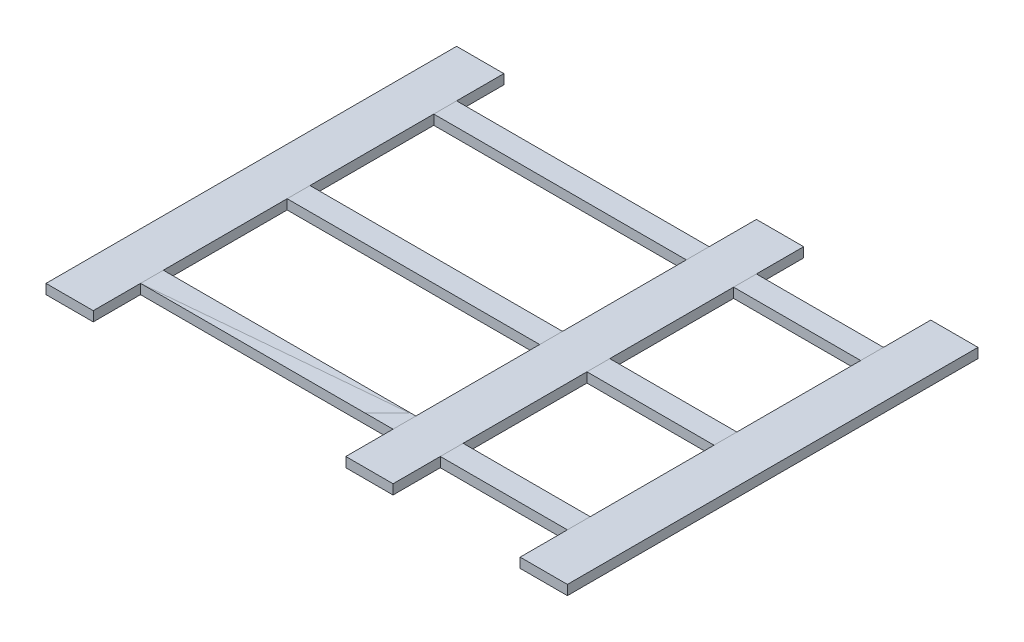
from build123d import *

# Parameters (mm, degrees)
SKETCH112_W                            = 38.1
SKETCH112_H                            = 88.9
WOODEN_STUD_CONFIGURED_2_X_4_2_DEPTH   = 1168.4
SKETCH112_ON_SEGMENT_2_W               = 38.1
SKETCH112_ON_SEGMENT_2_H               = 88.9
WOODEN_STUD_CONFIGURED_2_X_4_2_2_DEPTH = 1168.4
SKETCH112_ON_SEGMENT_3_W               = 38.1
SKETCH112_ON_SEGMENT_3_H               = 88.9
WOODEN_STUD_CONFIGURED_2_X_4_2_3_DEPTH = 1168.4
SKETCH112_ON_SEGMENT_4_W               = 38.1
SKETCH112_ON_SEGMENT_4_H               = 88.9
WOODEN_STUD_CONFIGURED_2_X_4_2_4_DEPTH = 679.45
SKETCH112_ON_SEGMENT_5_W               = 38.1
SKETCH112_ON_SEGMENT_5_H               = 88.9
WOODEN_STUD_CONFIGURED_2_X_4_2_5_DEPTH = 679.45
SKETCH112_ON_SEGMENT_6_W               = 38.1
SKETCH112_ON_SEGMENT_6_H               = 88.9
WOODEN_STUD_CONFIGURED_2_X_4_2_6_DEPTH = 679.45
SKETCH114_W                            = 38.1
SKETCH114_H                            = 184.15
WOODEN_STUD_CONFIGURED_2_X_8_3_DEPTH   = 1600.2
SKETCH114_ON_SEGMENT_2_W               = 38.1
SKETCH114_ON_SEGMENT_2_H               = 184.15
WOODEN_STUD_CONFIGURED_2_X_8_3_2_DEPTH = 1600.2
SKETCH114_ON_SEGMENT_3_W               = 38.1
SKETCH114_ON_SEGMENT_3_H               = 184.15
WOODEN_STUD_CONFIGURED_2_X_8_3_3_DEPTH = 1600.2
TRIM_EXTEND3_START                     = 1168.4
TRIM_EXTEND3_OUTLINE_W                 = 38.1
TRIM_EXTEND3_OUTLINE_H                 = 88.9
TRIM_EXTEND3_DEPTH                     = 92.075
TRIM_EXTEND3_START_2                   = 1755.775
TRIM_EXTEND3_2_OUTLINE_W               = 38.1
TRIM_EXTEND3_2_OUTLINE_H               = 88.9
TRIM_EXTEND3_2_DEPTH                   = 92.075
TRIM_EXTEND3_3_OUTLINE_W               = 38.1
TRIM_EXTEND3_3_OUTLINE_H               = 88.9
TRIM_EXTEND3_3_DEPTH                   = 92.075
TRIM_EXTEND3_START_3                   = 1076.325
TRIM_EXTEND3_4_OUTLINE_W               = 38.1
TRIM_EXTEND3_4_OUTLINE_H               = 88.9
TRIM_EXTEND3_4_DEPTH                   = 92.075
TRIM_EXTEND3_5_OUTLINE_W               = 38.1
TRIM_EXTEND3_5_OUTLINE_H               = 88.9
TRIM_EXTEND3_5_DEPTH                   = 92.075
TRIM_EXTEND3_6_OUTLINE_W               = 38.1
TRIM_EXTEND3_6_OUTLINE_H               = 88.9
TRIM_EXTEND3_6_DEPTH                   = 92.075
TRIM_EXTEND3_7_OUTLINE_W               = 38.1
TRIM_EXTEND3_7_OUTLINE_H               = 88.9
TRIM_EXTEND3_7_DEPTH                   = 92.075
TRIM_EXTEND3_8_OUTLINE_W               = 38.1
TRIM_EXTEND3_8_OUTLINE_H               = 88.9
TRIM_EXTEND3_8_DEPTH                   = 92.075
TRIM_EXTEND3_9_OUTLINE_W               = 38.1
TRIM_EXTEND3_9_OUTLINE_H               = 88.9
TRIM_EXTEND3_9_DEPTH                   = 92.075
TRIM_EXTEND3_10_OUTLINE_W              = 38.1
TRIM_EXTEND3_10_OUTLINE_H              = 88.9
TRIM_EXTEND3_10_DEPTH                  = 92.075
TRIM_EXTEND3_11_OUTLINE_W              = 38.1
TRIM_EXTEND3_11_OUTLINE_H              = 88.9
TRIM_EXTEND3_11_DEPTH                  = 92.075
TRIM_EXTEND3_12_OUTLINE_W              = 38.1
TRIM_EXTEND3_12_OUTLINE_H              = 88.9
TRIM_EXTEND3_12_DEPTH                  = 92.075
TRIM_EXTEND3_START_4                   = -273.05
TRIM_EXTEND3_13_OUTLINE_W              = 495.3
TRIM_EXTEND3_13_OUTLINE_H              = 38.1
TRIM_EXTEND3_13_DEPTH                  = 88.9
TRIM_EXTEND3_14_OUTLINE_W              = 984.25
TRIM_EXTEND3_14_OUTLINE_H              = 38.1
TRIM_EXTEND3_14_DEPTH                  = 88.9
TRIM_EXTEND3_START_5                   = -844.55
TRIM_EXTEND3_15_OUTLINE_W              = 495.3
TRIM_EXTEND3_15_OUTLINE_H              = 38.1
TRIM_EXTEND3_15_DEPTH                  = 88.9
TRIM_EXTEND3_16_OUTLINE_W              = 984.25
TRIM_EXTEND3_16_OUTLINE_H              = 38.1
TRIM_EXTEND3_16_DEPTH                  = 88.9
TRIM_EXTEND3_START_6                   = -1416.05
TRIM_EXTEND3_17_OUTLINE_W              = 495.3
TRIM_EXTEND3_17_OUTLINE_H              = 38.1
TRIM_EXTEND3_17_DEPTH                  = 88.9
TRIM_EXTEND3_18_OUTLINE_W              = 984.25
TRIM_EXTEND3_18_OUTLINE_H              = 38.1
TRIM_EXTEND3_18_DEPTH                  = 88.9


# Read off the part's stored shape, not the designer's step: Trim/Extend3
with BuildPart() as part:
    # Sketch112 → Wooden-stud - configured 2 X 4(2) (new body)
    with BuildSketch(Plane(origin=(0, 0, -228.6), x_dir=(0, 1, 0), z_dir=(1, 0, 0))):
        Rectangle(SKETCH112_W, SKETCH112_H)
    extrude(amount=WOODEN_STUD_CONFIGURED_2_X_4_2_DEPTH)

    # Trim_Extend3 3 outline → Trim_Extend3 3 (cut)
    with BuildSketch(Plane.YZ):
        with Locations((0, -228.6)):
            Rectangle(TRIM_EXTEND3_3_OUTLINE_W, TRIM_EXTEND3_3_OUTLINE_H)
    extrude(amount=TRIM_EXTEND3_3_DEPTH, mode=Mode.SUBTRACT)

    # Trim_Extend3 4 outline → Trim_Extend3 4 (cut)
    with BuildSketch(Plane.YZ.offset(TRIM_EXTEND3_START_3)):
        with Locations((0, -228.6)):
            Rectangle(TRIM_EXTEND3_4_OUTLINE_W, TRIM_EXTEND3_4_OUTLINE_H)
    extrude(amount=TRIM_EXTEND3_4_DEPTH, mode=Mode.SUBTRACT)


with BuildPart() as body_2:
    # Sketch112 on segment 2 (carried to segment 2) → Wooden-stud - configured 2 X 4_2 2 (new body)
    with BuildSketch(Plane(origin=(0, 0, -800.1), x_dir=(0, 1, 0), z_dir=(1, 0, 0))):
        Rectangle(SKETCH112_ON_SEGMENT_2_W, SKETCH112_ON_SEGMENT_2_H)
    extrude(amount=WOODEN_STUD_CONFIGURED_2_X_4_2_2_DEPTH)

    # Trim_Extend3 7 outline → Trim_Extend3 7 (cut)
    with BuildSketch(Plane.YZ):
        with Locations((0, -800.1)):
            Rectangle(TRIM_EXTEND3_7_OUTLINE_W, TRIM_EXTEND3_7_OUTLINE_H)
    extrude(amount=TRIM_EXTEND3_7_DEPTH, mode=Mode.SUBTRACT)

    # Trim_Extend3 8 outline → Trim_Extend3 8 (cut)
    with BuildSketch(Plane.YZ.offset(TRIM_EXTEND3_START_3)):
        with Locations((0, -800.1)):
            Rectangle(TRIM_EXTEND3_8_OUTLINE_W, TRIM_EXTEND3_8_OUTLINE_H)
    extrude(amount=TRIM_EXTEND3_8_DEPTH, mode=Mode.SUBTRACT)


with BuildPart() as body_3:
    # Sketch112 on segment 3 (carried to segment 3) → Wooden-stud - configured 2 X 4_2 3 (new body)
    with BuildSketch(Plane(origin=(0, 0, -1371.6), x_dir=(0, 1, 0), z_dir=(1, 0, 0))):
        Rectangle(SKETCH112_ON_SEGMENT_3_W, SKETCH112_ON_SEGMENT_3_H)
    extrude(amount=WOODEN_STUD_CONFIGURED_2_X_4_2_3_DEPTH)

    # Trim_Extend3 11 outline → Trim_Extend3 11 (cut)
    with BuildSketch(Plane.YZ):
        with Locations((0, -1371.6)):
            Rectangle(TRIM_EXTEND3_11_OUTLINE_W, TRIM_EXTEND3_11_OUTLINE_H)
    extrude(amount=TRIM_EXTEND3_11_DEPTH, mode=Mode.SUBTRACT)

    # Trim_Extend3 12 outline → Trim_Extend3 12 (cut)
    with BuildSketch(Plane.YZ.offset(TRIM_EXTEND3_START_3)):
        with Locations((0, -1371.6)):
            Rectangle(TRIM_EXTEND3_12_OUTLINE_W, TRIM_EXTEND3_12_OUTLINE_H)
    extrude(amount=TRIM_EXTEND3_12_DEPTH, mode=Mode.SUBTRACT)


with BuildPart() as body_4:
    # Sketch112 on segment 4 (carried to segment 4) → Wooden-stud - configured 2 X 4_2 4 (new body)
    with BuildSketch(Plane(origin=(1168.4, 0, -1371.6), x_dir=(0, 1, 0), z_dir=(1, 0, 0))):
        Rectangle(SKETCH112_ON_SEGMENT_4_W, SKETCH112_ON_SEGMENT_4_H)
    extrude(amount=WOODEN_STUD_CONFIGURED_2_X_4_2_4_DEPTH)

    # Trim_Extend3 9 outline → Trim_Extend3 9 (cut)
    with BuildSketch(Plane.YZ.offset(TRIM_EXTEND3_START)):
        with Locations((0, -1371.6)):
            Rectangle(TRIM_EXTEND3_9_OUTLINE_W, TRIM_EXTEND3_9_OUTLINE_H)
    extrude(amount=TRIM_EXTEND3_9_DEPTH, mode=Mode.SUBTRACT)

    # Trim_Extend3 10 outline → Trim_Extend3 10 (cut)
    with BuildSketch(Plane.YZ.offset(TRIM_EXTEND3_START_2)):
        with Locations((0, -1371.6)):
            Rectangle(TRIM_EXTEND3_10_OUTLINE_W, TRIM_EXTEND3_10_OUTLINE_H)
    extrude(amount=TRIM_EXTEND3_10_DEPTH, mode=Mode.SUBTRACT)


with BuildPart() as body_5:
    # Sketch112 on segment 5 (carried to segment 5) → Wooden-stud - configured 2 X 4_2 5 (new body)
    with BuildSketch(Plane(origin=(1168.4, 0, -800.1), x_dir=(0, 1, 0), z_dir=(1, 0, 0))):
        Rectangle(SKETCH112_ON_SEGMENT_5_W, SKETCH112_ON_SEGMENT_5_H)
    extrude(amount=WOODEN_STUD_CONFIGURED_2_X_4_2_5_DEPTH)

    # Trim_Extend3 5 outline → Trim_Extend3 5 (cut)
    with BuildSketch(Plane.YZ.offset(TRIM_EXTEND3_START)):
        with Locations((0, -800.1)):
            Rectangle(TRIM_EXTEND3_5_OUTLINE_W, TRIM_EXTEND3_5_OUTLINE_H)
    extrude(amount=TRIM_EXTEND3_5_DEPTH, mode=Mode.SUBTRACT)

    # Trim_Extend3 6 outline → Trim_Extend3 6 (cut)
    with BuildSketch(Plane.YZ.offset(TRIM_EXTEND3_START_2)):
        with Locations((0, -800.1)):
            Rectangle(TRIM_EXTEND3_6_OUTLINE_W, TRIM_EXTEND3_6_OUTLINE_H)
    extrude(amount=TRIM_EXTEND3_6_DEPTH, mode=Mode.SUBTRACT)


with BuildPart() as body_6:
    # Sketch112 on segment 6 (carried to segment 6) → Wooden-stud - configured 2 X 4_2 6 (new body)
    with BuildSketch(Plane(origin=(1168.4, 0, -228.6), x_dir=(0, 1, 0), z_dir=(1, 0, 0))):
        Rectangle(SKETCH112_ON_SEGMENT_6_W, SKETCH112_ON_SEGMENT_6_H)
    extrude(amount=WOODEN_STUD_CONFIGURED_2_X_4_2_6_DEPTH)

    # Trim/Extend3 outline → Trim/Extend3 (cut)
    with BuildSketch(Plane.YZ.offset(TRIM_EXTEND3_START)):
        with Locations((0, -228.6)):
            Rectangle(TRIM_EXTEND3_OUTLINE_W, TRIM_EXTEND3_OUTLINE_H)
    extrude(amount=TRIM_EXTEND3_DEPTH, mode=Mode.SUBTRACT)

    # Trim_Extend3 2 outline → Trim_Extend3 2 (cut)
    with BuildSketch(Plane.YZ.offset(TRIM_EXTEND3_START_2)):
        with Locations((0, -228.6)):
            Rectangle(TRIM_EXTEND3_2_OUTLINE_W, TRIM_EXTEND3_2_OUTLINE_H)
    extrude(amount=TRIM_EXTEND3_2_DEPTH, mode=Mode.SUBTRACT)


with BuildPart() as body_7:
    # Sketch114 → Wooden-stud - configured 2 X 8(3) (new body)
    with BuildSketch(Plane(origin=(0, 0, -1600.2), x_dir=(0, 1, 0), z_dir=(0, 0, 1))):
        Rectangle(SKETCH114_W, SKETCH114_H)
    extrude(amount=WOODEN_STUD_CONFIGURED_2_X_8_3_DEPTH)


with BuildPart() as body_8:
    # Sketch114 on segment 2 (carried to segment 2) → Wooden-stud - configured 2 X 8_3 2 (new body)
    with BuildSketch(Plane(origin=(1168.4, 0, -1600.2), x_dir=(0, 1, 0), z_dir=(0, 0, 1))):
        Rectangle(SKETCH114_ON_SEGMENT_2_W, SKETCH114_ON_SEGMENT_2_H)
    extrude(amount=WOODEN_STUD_CONFIGURED_2_X_8_3_2_DEPTH)


with BuildPart() as body_9:
    # Sketch114 on segment 3 (carried to segment 3) → Wooden-stud - configured 2 X 8_3 3 (new body)
    with BuildSketch(Plane(origin=(1847.85, 0, -1600.2), x_dir=(0, 1, 0), z_dir=(0, 0, 1))):
        Rectangle(SKETCH114_ON_SEGMENT_3_W, SKETCH114_ON_SEGMENT_3_H)
    extrude(amount=WOODEN_STUD_CONFIGURED_2_X_8_3_3_DEPTH)


with BuildPart() as body_10:
    # Trim_Extend3 13 outline → Trim_Extend3 13 (new body)
    with BuildSketch(Plane.XY.offset(TRIM_EXTEND3_START_4)):
        with Locations((1508.125, 0)):
            Rectangle(TRIM_EXTEND3_13_OUTLINE_W, TRIM_EXTEND3_13_OUTLINE_H)
    extrude(amount=TRIM_EXTEND3_13_DEPTH)


with BuildPart() as body_11:
    # Trim_Extend3 14 outline → Trim_Extend3 14 (new body)
    with BuildSketch(Plane.XY.offset(TRIM_EXTEND3_START_4)):
        with Locations((584.2, 0)):
            Rectangle(TRIM_EXTEND3_14_OUTLINE_W, TRIM_EXTEND3_14_OUTLINE_H)
    extrude(amount=TRIM_EXTEND3_14_DEPTH)


with BuildPart() as body_12:
    # Trim_Extend3 15 outline → Trim_Extend3 15 (new body)
    with BuildSketch(Plane.XY.offset(TRIM_EXTEND3_START_5)):
        with Locations((1508.125, 0)):
            Rectangle(TRIM_EXTEND3_15_OUTLINE_W, TRIM_EXTEND3_15_OUTLINE_H)
    extrude(amount=TRIM_EXTEND3_15_DEPTH)


with BuildPart() as body_13:
    # Trim_Extend3 16 outline → Trim_Extend3 16 (new body)
    with BuildSketch(Plane.XY.offset(TRIM_EXTEND3_START_5)):
        with Locations((584.2, 0)):
            Rectangle(TRIM_EXTEND3_16_OUTLINE_W, TRIM_EXTEND3_16_OUTLINE_H)
    extrude(amount=TRIM_EXTEND3_16_DEPTH)


with BuildPart() as body_14:
    # Trim_Extend3 17 outline → Trim_Extend3 17 (new body)
    with BuildSketch(Plane.XY.offset(TRIM_EXTEND3_START_6)):
        with Locations((1508.125, 0)):
            Rectangle(TRIM_EXTEND3_17_OUTLINE_W, TRIM_EXTEND3_17_OUTLINE_H)
    extrude(amount=TRIM_EXTEND3_17_DEPTH)


with BuildPart() as body_15:
    # Trim_Extend3 18 outline → Trim_Extend3 18 (new body)
    with BuildSketch(Plane.XY.offset(TRIM_EXTEND3_START_6)):
        with Locations((584.2, 0)):
            Rectangle(TRIM_EXTEND3_18_OUTLINE_W, TRIM_EXTEND3_18_OUTLINE_H)
    extrude(amount=TRIM_EXTEND3_18_DEPTH)


solid = Compound([part.part, body_2.part, body_3.part, body_4.part, body_5.part, body_6.part, body_7.part, body_8.part, body_9.part, body_10.part, body_11.part, body_12.part, body_13.part, body_14.part, body_15.part])
